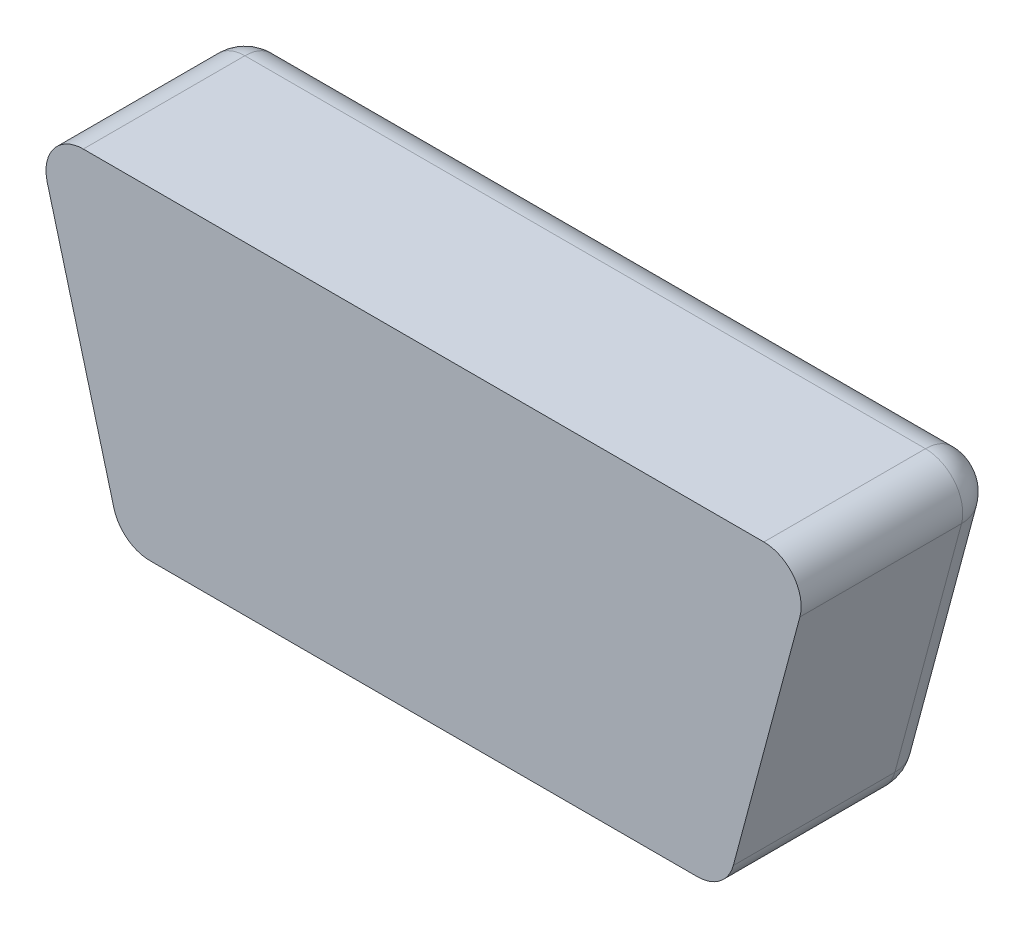
from build123d import *

# Parameters (mm, degrees)
EXTRUDE_1_DEPTH = 4
FILLET_1_R      = 0.75


with BuildPart() as part:
    # Эскиз1 → Бобышка-Вытянуть1 (new body)
    with BuildSketch(Plane.XY):
        Polygon((-6.08, -3.25), (6.08, -3.25), (7.821669751, 3.25), (-7.821669751, 3.25), align=None)
    extrude(amount=EXTRUDE_1_DEPTH)

    # Скругление1
    fillet_1_edges = [part.edges().sort_by_distance(p)[0] for p in [
        (-7.821669751, 3.25, 2),
        (-6.08, -3.25, 2),
        (-6.950834875, 0, 0),
        (0, -3.25, 0),
        (6.08, -3.25, 2),
        (6.950834875, 0, 0),
        (0, 3.25, 0),
        (7.821669751, 3.25, 2),
    ]]
    fillet(fillet_1_edges, radius=FILLET_1_R)


solid = part.part
